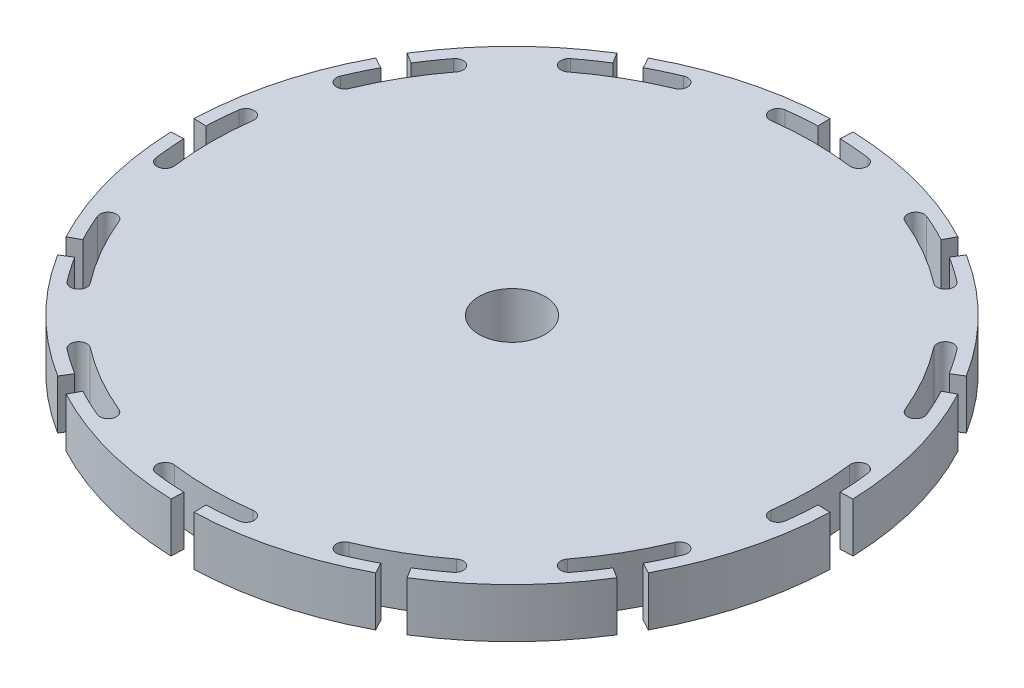
from build123d import *

# Parameters (mm, degrees)
SKETCH1_R         = 40
WHEEL_BLANK_DEPTH = 6
T_SLOT_DEPTH      = 57.885850613
CIRPATTERN_COUNT  = 12
SKETCH3_R         = 4
CENTER_HOLE_DEPTH = 6


with BuildPart() as part:
    # Sketch1 → Wheel Blank (new body)
    with BuildSketch(Plane(origin=(0, 0, 0), x_dir=(1, 0, 0), z_dir=(0, 1, 0))):
        Circle(SKETCH1_R)
    extrude(amount=WHEEL_BLANK_DEPTH)

    # Sketch2 → T-Slot (cut, through all)
    with BuildSketch(Plane(origin=(0, 0, 0), x_dir=(1, 0, 0), z_dir=(0, 1, 0))):
        with BuildLine():
            Line((-1.395979868, 39.975633081), (-1.343630623, 38.47654684))
            ThreePointArc((-1.343630623, 38.47654684), (-3.188115989, 38.367771846), (-5.0252584, 38.170627163))
            ThreePointArc((-5.0252584, 38.170627163), (-5.88617707, 37.048656109), (-4.764206016, 36.18773744))
            ThreePointArc((-4.764206016, 36.18773744), (0, 36.5), (4.764206016, 36.18773744))
            ThreePointArc((4.764206016, 36.18773744), (5.88617707, 37.048656109), (5.0252584, 38.170627163))
            ThreePointArc((5.0252584, 38.170627163), (3.188115989, 38.367771846), (1.343630623, 38.47654684))
            Line((1.343630623, 38.47654684), (1.395979868, 39.975633081))
            ThreePointArc((1.395979868, 39.975633081), (0, 40), (-1.395979868, 39.975633081))
        make_face()
    t_slot = extrude(amount=T_SLOT_DEPTH, mode=Mode.SUBTRACT)

    # CirPattern: T-Slot ×12 about axis
    cirpattern_axis = Axis((0, 6, 0), (0, -1, 0))
    for i in range(1, CIRPATTERN_COUNT):
        add(t_slot.rotate(cirpattern_axis, i * 360 / CIRPATTERN_COUNT), mode=Mode.SUBTRACT)

    # Sketch3 → Center Hole (cut)
    with BuildSketch(Plane(origin=(0, 0, 0), x_dir=(1, 0, 0), z_dir=(0, 1, 0))):
        Circle(SKETCH3_R)
    extrude(amount=CENTER_HOLE_DEPTH, mode=Mode.SUBTRACT)


solid = part.part
